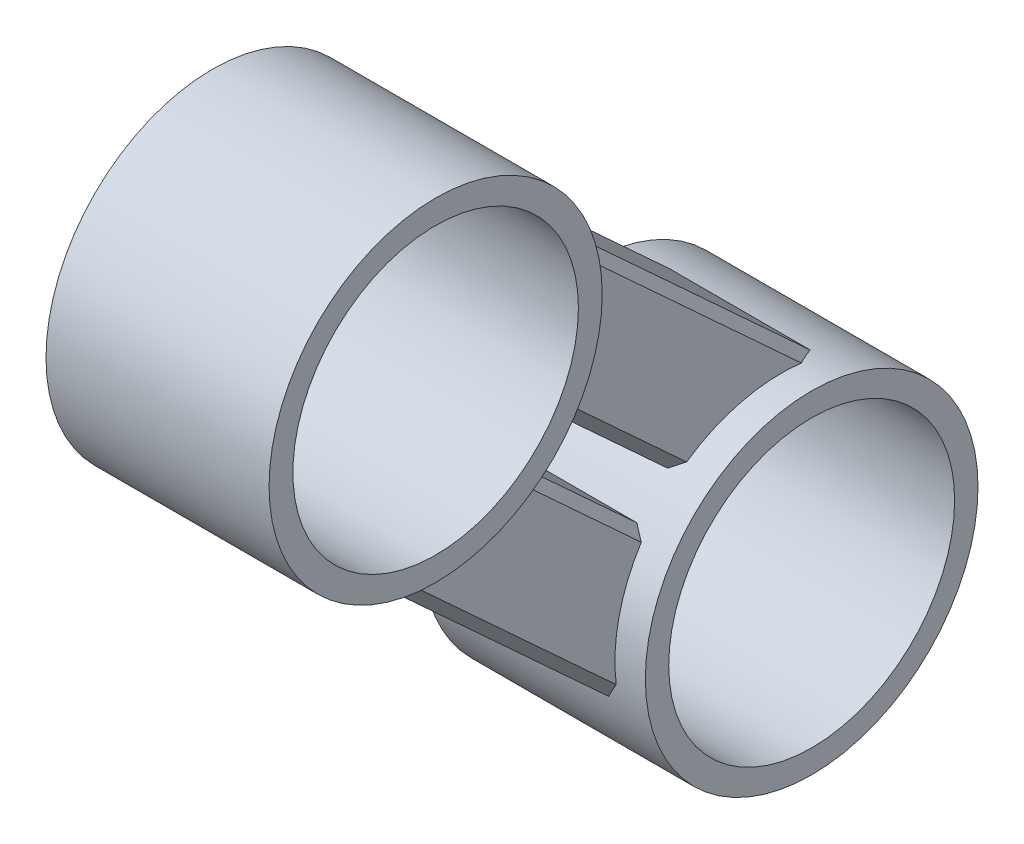
from build123d import *

# Parameters (mm, degrees)
BOSS_EXTRUDE2_DEPTH      = 14.713204
BOSS_EXTRUDE2_DEPTH_BACK = 14.713204
BOSS_EXTRUDE3_DEPTH      = 20.236561
BOSS_EXTRUDE3_DEPTH_BACK = 20.236561
SKETCH2_R                = 25.902158
SKETCH2_R_2              = 25.939329669
CUT_EXTRUDE1_DEPTH       = 547.956280292
CHAMFER1_SIZE            = 1.894586


with BuildPart() as part:
    # Sketch1 → Boss-Extrude2 (new, two sides: drawn at the far end of the back side and taken through both)
    with BuildSketch(Plane(origin=(0, 0, 0), x_dir=(0, 0, -1), z_dir=(1, 0, 0)).offset(-BOSS_EXTRUDE2_DEPTH_BACK)):
        with BuildLine():
            ThreePointArc((37.530301218, 479.004762545), (25.455145516, 473.112329842), (12.01921241, 473.035844862))
            Line((12.01921241, 473.035844862), (57.410437724, 431.307373701))
            ThreePointArc((57.410437724, 431.307373701), (57.237962601, 444.238910489), (62.494422204, 456.05517148))
            Line((62.494422204, 456.05517148), (37.530301218, 479.004762545))
        make_face()
        with BuildLine():
            Line((93.941121838, 467.486529022), (47.908047204, 509.804855969))
            ThreePointArc((47.908047204, 509.804855969), (48.571470239, 506.200224369), (48.793700581, 502.541794))
            ThreePointArc((48.793700581, 502.541794), (47.325762011, 493.23696216), (43.064536592, 484.835968341))
            Line((43.064536592, 484.835968341), (68.081105171, 461.838170852))
            ThreePointArc((68.081105171, 461.838170852), (80.358782988, 467.648930733), (93.941121838, 467.486529022))
        make_face()
        with BuildLine():
            Line((0.348742, 483.76459), (12.01921241, 473.035844862))
            ThreePointArc((12.01921241, 473.035844862), (25.455145516, 473.112329842), (37.530301218, 479.004762545))
            Line((37.530301218, 479.004762545), (15.677896, 499.093744))
            Line((15.677896, 499.093744), (0.348742, 483.76459))
        make_face()
        with BuildLine():
            Line((47.908047204, 509.804855969), (36.696142, 520.11199))
            Line((36.696142, 520.11199), (21.366988, 504.782582))
            Line((21.366988, 504.782582), (43.064536592, 484.835968341))
            ThreePointArc((43.064536592, 484.835968341), (47.325762011, 493.23696216), (48.793700581, 502.541794))
            ThreePointArc((48.793700581, 502.541794), (48.571470239, 506.200224369), (47.908047204, 509.804855969))
        make_face()
        with BuildLine():
            Line((21.366988, 504.782582), (36.696142, 520.11199))
            Line((36.696142, 520.11199), (47.908047204, 509.804855969))
            ThreePointArc((47.908047204, 509.804855969), (-3.059663869, 523.653132734), (12.01921241, 473.035844862))
            Line((12.01921241, 473.035844862), (0.348742, 483.76459))
            Line((0.348742, 483.76459), (15.677896, 499.093744))
            Line((15.677896, 499.093744), (37.530301218, 479.004762545))
            ThreePointArc((37.530301218, 479.004762545), (40.492163472, 481.735538786), (43.064536592, 484.835968341))
            Line((43.064536592, 484.835968341), (21.366988, 504.782582))
        make_face()
        with BuildLine():
            ThreePointArc((116.976157863, 438.166256), (110.528637975, 456.809561064), (93.941121838, 467.486529022))
            Line((93.941121838, 467.486529022), (94.929198, 466.578188))
            Line((94.929198, 466.578188), (79.600044, 451.24878))
            Line((79.600044, 451.24878), (68.081105171, 461.838170852))
            ThreePointArc((68.081105171, 461.838170852), (65.094293396, 459.13357369), (62.494422204, 456.05517148))
            Line((62.494422204, 456.05517148), (73.911206, 445.559688))
            Line((73.911206, 445.559688), (58.581798, 430.230534))
            Line((58.581798, 430.230534), (57.410437724, 431.307373701))
            ThreePointArc((57.410437724, 431.307373701), (90.250505926, 408.186599222), (116.976157863, 438.166256))
        make_face()
        with BuildLine():
            Line((94.929198, 466.578188), (93.941121838, 467.486529022))
            ThreePointArc((93.941121838, 467.486529022), (80.358782988, 467.648930733), (68.081105171, 461.838170852))
            Line((68.081105171, 461.838170852), (79.600044, 451.24878))
            Line((79.600044, 451.24878), (94.929198, 466.578188))
        make_face()
        with BuildLine():
            ThreePointArc((62.494422204, 456.05517148), (57.237962601, 444.238910489), (57.410437724, 431.307373701))
            Line((57.410437724, 431.307373701), (58.581798, 430.230534))
            Line((58.581798, 430.230534), (73.911206, 445.559688))
            Line((73.911206, 445.559688), (62.494422204, 456.05517148))
        make_face()
    extrude(amount=BOSS_EXTRUDE2_DEPTH + BOSS_EXTRUDE2_DEPTH_BACK)

    # Sketch1<3> → Boss-Extrude3 (add, two sides: drawn at the far end of the back side and taken through both)
    with BuildSketch(Plane(origin=(0, 0, 0), x_dir=(0, 0, -1), z_dir=(1, 0, 0)).offset(-BOSS_EXTRUDE3_DEPTH_BACK)):
        with BuildLine():
            Line((21.366988, 504.782582), (36.696142, 520.11199))
            Line((36.696142, 520.11199), (47.908047204, 509.804855969))
            ThreePointArc((47.908047204, 509.804855969), (-3.059663869, 523.653132734), (12.01921241, 473.035844862))
            Line((12.01921241, 473.035844862), (0.348742, 483.76459))
            Line((0.348742, 483.76459), (15.677896, 499.093744))
            Line((15.677896, 499.093744), (37.530301218, 479.004762545))
            ThreePointArc((37.530301218, 479.004762545), (40.492163472, 481.735538786), (43.064536592, 484.835968341))
            Line((43.064536592, 484.835968341), (21.366988, 504.782582))
        make_face()
        with BuildLine():
            ThreePointArc((116.976157863, 438.166256), (110.528637975, 456.809561064), (93.941121838, 467.486529022))
            Line((93.941121838, 467.486529022), (94.929198, 466.578188))
            Line((94.929198, 466.578188), (79.600044, 451.24878))
            Line((79.600044, 451.24878), (68.081105171, 461.838170852))
            ThreePointArc((68.081105171, 461.838170852), (65.094293396, 459.13357369), (62.494422204, 456.05517148))
            Line((62.494422204, 456.05517148), (73.911206, 445.559688))
            Line((73.911206, 445.559688), (58.581798, 430.230534))
            Line((58.581798, 430.230534), (57.410437724, 431.307373701))
            ThreePointArc((57.410437724, 431.307373701), (90.250505926, 408.186599222), (116.976157863, 438.166256))
        make_face()
        with BuildLine():
            ThreePointArc((62.494422204, 456.05517148), (57.237962601, 444.238910489), (57.410437724, 431.307373701))
            Line((57.410437724, 431.307373701), (58.581798, 430.230534))
            Line((58.581798, 430.230534), (73.911206, 445.559688))
            Line((73.911206, 445.559688), (62.494422204, 456.05517148))
        make_face()
        with BuildLine():
            Line((94.929198, 466.578188), (93.941121838, 467.486529022))
            ThreePointArc((93.941121838, 467.486529022), (80.358782988, 467.648930733), (68.081105171, 461.838170852))
            Line((68.081105171, 461.838170852), (79.600044, 451.24878))
            Line((79.600044, 451.24878), (94.929198, 466.578188))
        make_face()
        with BuildLine():
            Line((47.908047204, 509.804855969), (36.696142, 520.11199))
            Line((36.696142, 520.11199), (21.366988, 504.782582))
            Line((21.366988, 504.782582), (43.064536592, 484.835968341))
            ThreePointArc((43.064536592, 484.835968341), (47.325762011, 493.23696216), (48.793700581, 502.541794))
            ThreePointArc((48.793700581, 502.541794), (48.571470239, 506.200224369), (47.908047204, 509.804855969))
        make_face()
        with BuildLine():
            Line((0.348742, 483.76459), (12.01921241, 473.035844862))
            ThreePointArc((12.01921241, 473.035844862), (25.455145516, 473.112329842), (37.530301218, 479.004762545))
            Line((37.530301218, 479.004762545), (15.677896, 499.093744))
            Line((15.677896, 499.093744), (0.348742, 483.76459))
        make_face()
    extrude(amount=BOSS_EXTRUDE3_DEPTH + BOSS_EXTRUDE3_DEPTH_BACK)

    # Sketch2 → Cut-Extrude1 (cut, through all)
    with BuildSketch(Plane(origin=(20.236561, 0, 0), x_dir=(0, 0, -1), z_dir=(1, 0, 0))):
        with Locations((18.569432, 502.541794)):
            Circle(SKETCH2_R)
        with Locations((86.798404, 438.166256)):
            Circle(SKETCH2_R_2)
    extrude(amount=-CUT_EXTRUDE1_DEPTH, mode=Mode.SUBTRACT)

    # Chamfer1
    # the kernel refuses this chamfer: 1.894586 mm, written as the material it takes off along each edge
    with BuildSketch(Plane(origin=(-14.713204, 482.302213593, -33.943397788), x_dir=(0.9996219169112971, 0.0202420968703396, -0.018608620176565335), z_dir=(0, -0.6767785744793956, -0.7361866347100016))) as chamfer1_piece_1_section:
        Polygon((CHAMFER1_SIZE * 0.999621916911, CHAMFER1_SIZE * 0.0274958766106), (-CHAMFER1_SIZE * 0.0274958766106, CHAMFER1_SIZE * 0.999621916911), (0, 0), align=None)
    chamfer1_piece_1 = extrude(amount=43.654592913, mode=Mode.PRIVATE)
    chamfer1_piece_1 = chamfer1_piece_1 - Plane(origin=(-14.082586432, 438.166256, -86.798404), x_dir=(0, 0.7844160622334895, 0.6202349887825632), z_dir=(-1, 0, 0)) * Cylinder(30.177753863, 95, mode=Mode.PRIVATE)
    chamfer1_piece_1 = chamfer1_piece_1 - Plane(origin=(-14.082586432, 502.541794, -18.569432), x_dir=(0, -0.7787461057189721, -0.6273392246843295), z_dir=(-1, 0, 0)) * Cylinder(30.224268581, 95, mode=Mode.PRIVATE)
    add(chamfer1_piece_1, mode=Mode.SUBTRACT)
    with BuildSketch(Plane(origin=(14.713204, 513.102306333, -44.321143144), x_dir=(0.027495876610586445, -0.7359084240497759, 0.6765225555604119), z_dir=(0, -0.6767784340411219, -0.7361867638153017))) as chamfer1_piece_2_section:
        Polygon((CHAMFER1_SIZE * 0.999621916911, CHAMFER1_SIZE * 0.0274958766106), (-CHAMFER1_SIZE * 0.0274958766106, CHAMFER1_SIZE * 0.999621916911), (0, 0), align=None)
    chamfer1_piece_2 = extrude(amount=72.273620457, mode=Mode.PRIVATE)
    chamfer1_piece_2 = chamfer1_piece_2 - Plane(origin=(14.076738279, 438.166256, -86.798404), x_dir=(0, 0.7844160622334895, 0.6202349887825632), z_dir=(-1, 0, 0)) * Cylinder(30.177753863, 153, mode=Mode.PRIVATE)
    chamfer1_piece_2 = chamfer1_piece_2 - Plane(origin=(14.076738279, 502.541794, -18.569432), x_dir=(0, -0.7787461057189721, -0.6273392246843295), z_dir=(-1, 0, 0)) * Cylinder(30.224268581, 153, mode=Mode.PRIVATE)
    add(chamfer1_piece_2, mode=Mode.SUBTRACT)
    with BuildSketch(Plane(origin=(14.713204, 458.540720488, -71.668009231), x_dir=(-0.9996219169112969, -0.02024210042020755, 0.018608616315095913), z_dir=(0, 0.6767784340411188, 0.7361867638153047))) as chamfer1_piece_3_section:
        Polygon((CHAMFER1_SIZE * 0.999621916911, -CHAMFER1_SIZE * 0.0274958766106), (-CHAMFER1_SIZE * 0.0274958766106, -CHAMFER1_SIZE * 0.999621916911), (0, 0), align=None)
    chamfer1_piece_3 = extrude(amount=43.725829206, mode=Mode.PRIVATE)
    chamfer1_piece_3 = chamfer1_piece_3 - Plane(origin=(14.082637489, 438.166256, -86.798404), x_dir=(0, 0.7844160622334895, 0.6202349887825632), z_dir=(-1, 0, 0)) * Cylinder(30.177753863, 96, mode=Mode.PRIVATE)
    chamfer1_piece_3 = chamfer1_piece_3 - Plane(origin=(14.082637489, 502.541794, -18.569432), x_dir=(0, -0.7787461057189721, -0.6273392246843295), z_dir=(-1, 0, 0)) * Cylinder(30.224268581, 96, mode=Mode.PRIVATE)
    add(chamfer1_piece_3, mode=Mode.SUBTRACT)
    with BuildSketch(Plane(origin=(14.713204, 452.757720432, -66.081325634), x_dir=(-0.9996219169112969, 0.02024209687034323, -0.01860862017656867), z_dir=(0, 0.6767785744793956, 0.7361866347100016))) as chamfer1_piece_4_section:
        Polygon((CHAMFER1_SIZE * 0.999621916911, CHAMFER1_SIZE * 0.0274958766106), (-CHAMFER1_SIZE * 0.0274958766106, CHAMFER1_SIZE * 0.999621916911), (0, 0), align=None)
    chamfer1_piece_4 = extrude(amount=43.654592913, mode=Mode.PRIVATE)
    chamfer1_piece_4 = chamfer1_piece_4 - Plane(origin=(14.082586432, 438.166256, -86.798404), x_dir=(0, 0.7844160622334895, 0.6202349887825632), z_dir=(-1, 0, 0)) * Cylinder(30.177753863, 95, mode=Mode.PRIVATE)
    chamfer1_piece_4 = chamfer1_piece_4 - Plane(origin=(14.082586432, 502.541794, -18.569432), x_dir=(0, -0.7787461057189721, -0.6273392246843295), z_dir=(-1, 0, 0)) * Cylinder(30.224268581, 95, mode=Mode.PRIVATE)
    add(chamfer1_piece_4, mode=Mode.SUBTRACT)
    with BuildSketch(Plane(origin=(-14.713204, 464.189078658, -97.528025897), x_dir=(-0.0274958766105856, -0.735908424049776, 0.6765225555604119), z_dir=(0, 0.6767784340411219, 0.7361867638153017))) as chamfer1_piece_5_section:
        Polygon((CHAMFER1_SIZE * 0.999621916911, CHAMFER1_SIZE * 0.0274958766106), (-CHAMFER1_SIZE * 0.0274958766106, CHAMFER1_SIZE * 0.999621916911), (0, 0), align=None)
    chamfer1_piece_5 = extrude(amount=72.273620457, mode=Mode.PRIVATE)
    chamfer1_piece_5 = chamfer1_piece_5 - Plane(origin=(-14.076738279, 438.166256, -86.798404), x_dir=(0, 0.7844160622334895, 0.6202349887825632), z_dir=(-1, 0, 0)) * Cylinder(30.177753863, 153, mode=Mode.PRIVATE)
    chamfer1_piece_5 = chamfer1_piece_5 - Plane(origin=(-14.076738279, 502.541794, -18.569432), x_dir=(0, -0.7787461057189721, -0.6273392246843295), z_dir=(-1, 0, 0)) * Cylinder(30.224268581, 153, mode=Mode.PRIVATE)
    add(chamfer1_piece_5, mode=Mode.SUBTRACT)
    with BuildSketch(Plane(origin=(14.713204, 428.009914857, -60.997333989), x_dir=(-0.9996219169112965, -0.0202420564302285, 0.01860866416646602), z_dir=(0, 0.6767801743515941, 0.7361851639394983))) as chamfer1_piece_6_section:
        Polygon((CHAMFER1_SIZE * 0.999621916911, -CHAMFER1_SIZE * 0.0274958766106), (-CHAMFER1_SIZE * 0.0274958766106, -CHAMFER1_SIZE * 0.999621916911), (0, 0), align=None)
    chamfer1_piece_6 = extrude(amount=71.401897808, mode=Mode.PRIVATE)
    chamfer1_piece_6 = chamfer1_piece_6 - Plane(origin=(14.076843775, 438.166256, -86.798404), x_dir=(0, 0.7844160622334895, 0.6202349887825632), z_dir=(-1, 0, 0)) * Cylinder(30.177753863, 151, mode=Mode.PRIVATE)
    chamfer1_piece_6 = chamfer1_piece_6 - Plane(origin=(14.076843775, 502.541794, -18.569432), x_dir=(0, -0.7787461057189721, -0.6273392246843295), z_dir=(-1, 0, 0)) * Cylinder(30.224268581, 151, mode=Mode.PRIVATE)
    add(chamfer1_piece_6, mode=Mode.SUBTRACT)
    with BuildSketch(Plane(origin=(-14.713204, 476.333303705, -8.432316145), x_dir=(-0.027495876610586514, 0.7359068247788585, -0.6765242952129021), z_dir=(0, -0.6767801743515941, -0.7361851639394983))) as chamfer1_piece_7_section:
        Polygon((CHAMFER1_SIZE * 0.999621916911, CHAMFER1_SIZE * 0.0274958766106), (-CHAMFER1_SIZE * 0.0274958766106, CHAMFER1_SIZE * 0.999621916911), (0, 0), align=None)
    chamfer1_piece_7 = extrude(amount=71.401897808, mode=Mode.PRIVATE)
    chamfer1_piece_7 = chamfer1_piece_7 - Plane(origin=(-14.076843775, 438.166256, -86.798404), x_dir=(0, 0.7844160622334895, 0.6202349887825632), z_dir=(-1, 0, 0)) * Cylinder(30.177753863, 151, mode=Mode.PRIVATE)
    chamfer1_piece_7 = chamfer1_piece_7 - Plane(origin=(-14.076843775, 502.541794, -18.569432), x_dir=(0, -0.7787461057189721, -0.6273392246843295), z_dir=(-1, 0, 0)) * Cylinder(30.224268581, 151, mode=Mode.PRIVATE)
    add(chamfer1_piece_7, mode=Mode.SUBTRACT)
    with BuildSketch(Plane(origin=(-14.713204, 488.133418705, -39.477632533), x_dir=(0.999621916911297, -0.020242100420206275, 0.01860861631509474), z_dir=(0, -0.6767784340411188, -0.7361867638153047))) as chamfer1_piece_8_section:
        Polygon((CHAMFER1_SIZE * 0.999621916911, -CHAMFER1_SIZE * 0.0274958766106), (-CHAMFER1_SIZE * 0.0274958766106, -CHAMFER1_SIZE * 0.999621916911), (0, 0), align=None)
    chamfer1_piece_8 = extrude(amount=43.725829206, mode=Mode.PRIVATE)
    chamfer1_piece_8 = chamfer1_piece_8 - Plane(origin=(-14.082637489, 438.166256, -86.798404), x_dir=(0, 0.7844160622334895, 0.6202349887825632), z_dir=(-1, 0, 0)) * Cylinder(30.177753863, 96, mode=Mode.PRIVATE)
    chamfer1_piece_8 = chamfer1_piece_8 - Plane(origin=(-14.082637489, 502.541794, -18.569432), x_dir=(0, -0.7787461057189721, -0.6273392246843295), z_dir=(-1, 0, 0)) * Cylinder(30.224268581, 96, mode=Mode.PRIVATE)
    add(chamfer1_piece_8, mode=Mode.SUBTRACT)


solid = part.part
